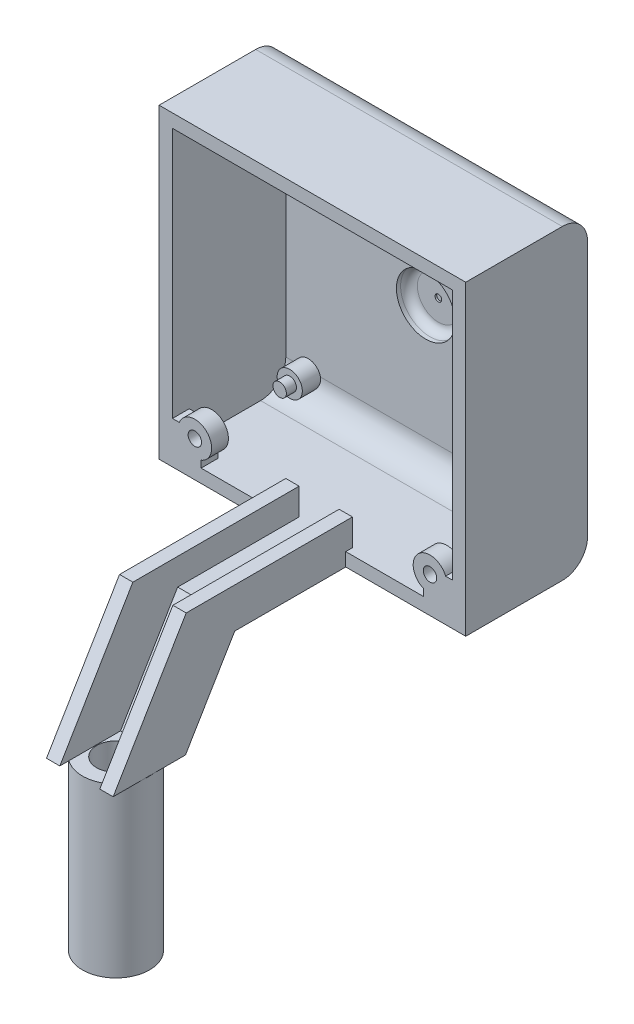
from build123d import *

# Parameters (mm, degrees)
SKETCH1_W            = 36.5125
SKETCH1_H            = 36.5125
EXTRUDE1_DEPTH       = 1
SKETCH2_W            = 36.5125
SKETCH2_H            = 36.5125
SKETCH2_W_2          = 33.3375
SKETCH2_H_2          = 33.3375
EXTRUDE2_DEPTH       = 13.5
FILLET7_R            = 3
SKETCH5_R            = 1.5
EXTRUDE5_DEPTH       = 2.2
SKETCH6_R            = 0.8
EXTRUDE6_DEPTH       = 1.2
SKETCH7_R            = 4.5
EXTRUDE7_DEPTH       = 2.5
SKETCH8_R            = 3.5
EXTRUDE9_DEPTH       = 1.5
FILLET8_R            = 1
FILLET10_R           = 1
SKETCH9_R            = 0.4
EXTRUDE10_DEPTH      = 0.2
EXTRUDE11_START      = -2
SKETCH10_R           = 0.8
EXTRUDE11_DEPTH      = 2
EXTRUDE12_DEPTH      = 19
EXTRUDE12_DEPTH_BACK = 0.8
EXTRUDE13_DEPTH      = 55.30808767
EXTRUDE14_DEPTH      = 17
EXTRUDE15_DEPTH      = 70.200859363
SKETCH16_R           = 4
SKETCH16_R_2         = 2.3
EXTRUDE16_DEPTH      = 20
SKETCH17_W           = 7.9375
SKETCH17_H           = 1.5875
EXTRUDE17_DEPTH      = 13.5


with BuildPart() as part:
    # Sketch1 → Extrude1 (new body)
    with BuildSketch(Plane.XY):
        with Locations((18.25625, -18.25625)):
            Rectangle(SKETCH1_W, SKETCH1_H)
    extrude(amount=EXTRUDE1_DEPTH)

    # Sketch2 → Extrude2 (add)
    with BuildSketch(Plane.XY.offset(1)):
        with Locations((18.25625, -18.25625)):
            Rectangle(SKETCH2_W, SKETCH2_H)
        with Locations((18.25625, -18.25625)):
            Rectangle(SKETCH2_W_2, SKETCH2_H_2, mode=Mode.SUBTRACT)
    extrude(amount=EXTRUDE2_DEPTH)

    # Fillet7
    fillet7_edges = [part.edges().sort_by_distance(p)[0] for p in [
        (18.25625, 0, 0),
        (18.25625, -36.5125, 0),
        (18.25625, -1.5875, 1),
        (18.25625, -34.925, 1),
    ]]
    fillet(fillet7_edges, radius=FILLET7_R)

    # Sketch5 → Extrude5 (add)
    with BuildSketch(Plane.XY.offset(1)):
        with Locations((4.25625, -4.25625)):
            Circle(SKETCH5_R)
        with Locations((32.25625, -4.25625)):
            Circle(SKETCH5_R)
        with Locations((4.25625, -32.25625)):
            Circle(SKETCH5_R)
        with Locations((32.25625, -32.25625)):
            Circle(SKETCH5_R)
    extrude(amount=EXTRUDE5_DEPTH)

    # Sketch6 → Extrude6 (add)
    with BuildSketch(Plane.XY.offset(3.2)):
        with Locations((4.25625, -32.25625)):
            Circle(SKETCH6_R)
        with Locations((32.25625, -32.25625)):
            Circle(SKETCH6_R)
        with Locations((4.25625, -4.25625)):
            Circle(SKETCH6_R)
        with Locations((32.25625, -4.25625)):
            Circle(SKETCH6_R)
    extrude(amount=EXTRUDE6_DEPTH)

    # Sketch7 → Extrude7 (add)
    with BuildSketch(Plane.XY.offset(1)):
        with Locations((18.25625, -18.25625)):
            Circle(SKETCH7_R)
    extrude(amount=-EXTRUDE7_DEPTH)

    # Sketch8 → Extrude9 (cut)
    with BuildSketch(Plane.XY.offset(1)):
        with Locations((18.25625, -18.25625)):
            Circle(SKETCH8_R)
    extrude(amount=-EXTRUDE9_DEPTH, mode=Mode.SUBTRACT)

    # Fillet8
    fillet8_edges = [part.edges().sort_by_distance(p)[0] for p in [
        (13.75625, -18.25625, -1.5),
    ]]
    fillet(fillet8_edges, radius=FILLET8_R)

    # Fillet10
    fillet10_edges = [part.edges().sort_by_distance(p)[0] for p in [
        (14.75625, -18.25625, -0.5),
    ]]
    fillet(fillet10_edges, radius=FILLET10_R)

    # Sketch9 → Extrude10 (cut)
    with BuildSketch(Plane.XY.offset(-0.5)):
        with Locations((18.25625, -18.25625)):
            Circle(SKETCH9_R)
    extrude(amount=-EXTRUDE10_DEPTH, mode=Mode.SUBTRACT)

    # Sketch10 → Extrude11 (add)
    # profile 1 of 2: a face of its own
    with BuildSketch(Plane.XY.offset(14.5).offset(EXTRUDE11_START)):
        with BuildLine():
            Line((31.5125, -34.11281563), (31.5125, -36.512569909))
            Line((31.5125, -36.512569909), (36.5125, -36.5125))
            Line((36.5125, -36.5125), (36.5125, -31.5125))
            Line((36.5125, -31.5125), (34.11281563, -31.5125))
            ThreePointArc((34.11281563, -31.5125), (30.842036438, -30.842036438), (31.5125, -34.11281563))
        make_face()
        with Locations((32.25625, -32.25625)):
            Circle(SKETCH10_R, mode=Mode.SUBTRACT)
    # profile 2 of 2: a face of its own
    with BuildSketch(Plane.XY.offset(14.5).offset(EXTRUDE11_START)):
        with BuildLine():
            Line((2.39968437, -31.5125), (0, -31.5125))
            Line((0, -31.5125), (0, -36.5125))
            Line((0, -36.5125), (5, -36.5125))
            Line((5, -36.5125), (5, -34.11281563))
            ThreePointArc((5, -34.11281563), (5.670463562, -30.842036438), (2.39968437, -31.5125))
        make_face()
        with Locations((4.25625, -32.25625)):
            Circle(SKETCH10_R, mode=Mode.SUBTRACT)
    extrude(amount=EXTRUDE11_DEPTH)

    # Sketch11 → Extrude12 (add, two sides: drawn at the far end of the back side and taken through both)
    with BuildSketch(Plane.XY.offset(14.5).offset(-EXTRUDE12_DEPTH_BACK)):
        Polygon((14.2875, -36.5125), (14.2875, -31.75), (15.875, -31.75), (15.875, -33.3375), (15.875, -34.925), (20.6375, -34.925), (20.6375, -33.3375), (20.6375, -31.75), (22.225, -31.75), (22.225, -36.5125), align=None)
    extrude(amount=EXTRUDE12_DEPTH + EXTRUDE12_DEPTH_BACK)

    # Sketch13 → Extrude13 (cut, through all)
    with BuildSketch(Plane.ZY.offset(-14.2875)):
        Polygon((33.5, -31.75), (25.5, -36.5125), (33.5, -36.5125), align=None)
    extrude(amount=-EXTRUDE13_DEPTH, mode=Mode.SUBTRACT)

    # Sketch14 → Extrude14 (add)
    with BuildSketch(Plane(origin=(0, -38.166778126, 22.721160103), x_dir=(1, 0, 0), z_dir=(0, -0.8592647834640841, 0.5115310664059621))):
        Polygon((22.225, 12.544258888), (22.225, 5.144258888), (14.2875, 5.144258888), (14.2875, 12.544258888), (15.875, 12.544258888), (15.875, 6.33740224), (20.6375, 6.33740224), (20.6375, 12.544258888), align=None)
    extrude(amount=EXTRUDE14_DEPTH)

    # Sketch15 → Extrude15 (cut, through all)
    with BuildSketch(Plane.ZY.offset(-14.2875)):
        Polygon((42.196028129, -46.357501319), (33.58401453, -46.357501319), (35.837468731, -50.14283121), align=None)
    extrude(amount=-EXTRUDE15_DEPTH, mode=Mode.SUBTRACT)

    # Sketch16 → Extrude16 (add)
    with BuildSketch(Plane.XZ.offset(46.357501319)):
        with Locations((18.25625, 37.89002133)):
            Circle(SKETCH16_R)
        with Locations((18.25625, 37.89002133)):
            Circle(SKETCH16_R_2, mode=Mode.SUBTRACT)
    extrude(amount=EXTRUDE16_DEPTH)

    # Sketch17 → Extrude17 (add)
    with BuildSketch(Plane.XY.offset(14.5)):
        with Locations((18.25625, -35.71875)):
            Rectangle(SKETCH17_W, SKETCH17_H)
    extrude(amount=EXTRUDE17_DEPTH)


solid = part.part
